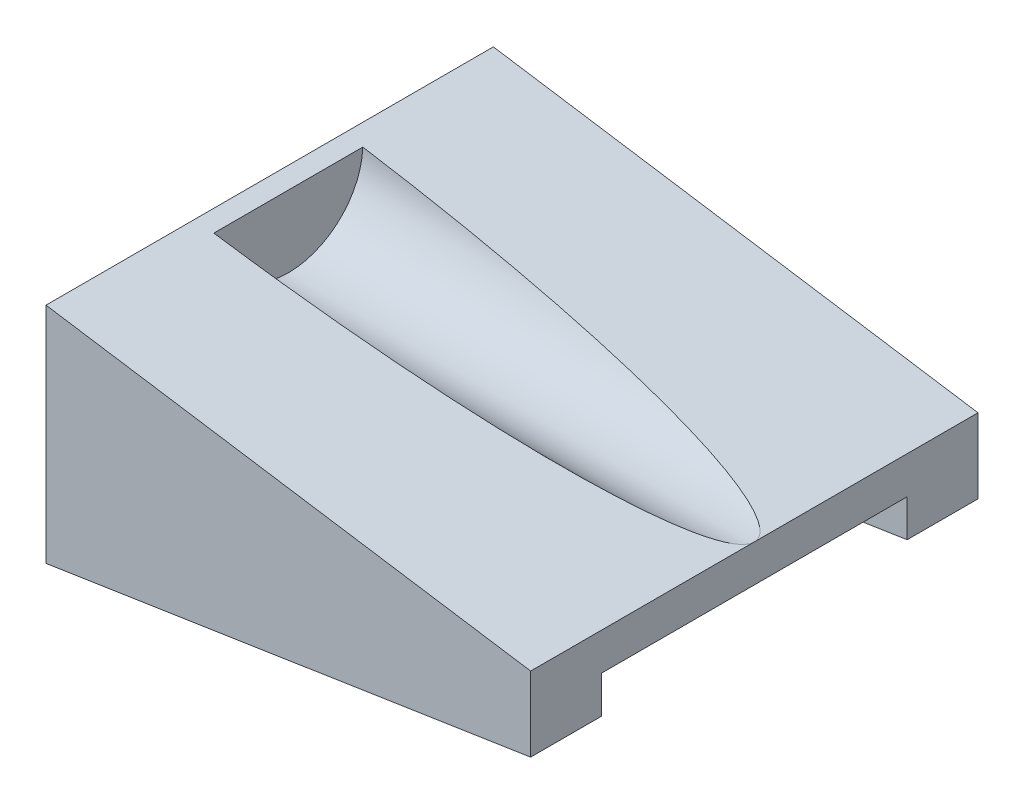
from build123d import *

# Parameters (mm, degrees)
SKETCH1_W           = 13
SKETCH1_H           = 12
BOSS_EXTRUDE1_DEPTH = 3
SKETCH2_W           = 13
SKETCH2_H           = 1.9
BOSS_EXTRUDE2_DEPTH = 3
CHAMFER1_SIZE       = 13
CHAMFER1_SIZE_2     = 2
CUT_EXTRUDE1_REACH  = 17.129
CUT_EXTRUDE1_START  = -0.5


with BuildPart() as part:
    # Sketch1 → Boss-Extrude1 (new body)
    with BuildSketch(Plane(origin=(0, 0, 0), x_dir=(1, 0, 0), z_dir=(0, 1, 0))):
        Rectangle(SKETCH1_W, SKETCH1_H)
    extrude(amount=BOSS_EXTRUDE1_DEPTH)

    # Sketch2 → Boss-Extrude2 (add)
    with BuildSketch(Plane.XZ):
        with Locations((0, 5.05)):
            Rectangle(SKETCH2_W, SKETCH2_H)
        with Locations((0, -5.05)):
            Rectangle(SKETCH2_W, SKETCH2_H)
    extrude(amount=BOSS_EXTRUDE2_DEPTH)

    # Chamfer1
    # the kernel refuses this chamfer: 13, 2 mm, written as the material it takes off along each edge
    with BuildSketch(Plane(origin=(6.5, -3, 39.785461495), x_dir=(-0.9999828835142526, -0.005850869894363576, 0), z_dir=(0, 0, -1))) as chamfer1_piece_1:
        Polygon((CHAMFER1_SIZE * 0.999982883514, CHAMFER1_SIZE * 0.00585086989436), (-CHAMFER1_SIZE_2 * 0.00585086989436, CHAMFER1_SIZE_2 * 0.999982883514), (0, 0), align=None)
    extrude(amount=69.470922991, mode=Mode.SUBTRACT)
    with BuildSketch(Plane(origin=(6.5, -3, -39.785461495), x_dir=(-0.9999828835142526, -0.005850869894363576, 0), z_dir=(0, 0, 1))) as chamfer1_piece_2:
        Polygon((CHAMFER1_SIZE * 0.999982883514, -CHAMFER1_SIZE * 0.00585086989436), (-CHAMFER1_SIZE_2 * 0.00585086989436, -CHAMFER1_SIZE_2 * 0.999982883514), (0, 0), align=None)
    extrude(amount=69.470922991, mode=Mode.SUBTRACT)
    with BuildSketch(Plane(origin=(6.5, 3, 39.785461495), x_dir=(0.23997968203750644, -0.9707779108576674, 0), z_dir=(0, 0, -1))) as chamfer1_piece_3:
        Polygon((CHAMFER1_SIZE_2 * 0.970777910858, CHAMFER1_SIZE_2 * 0.239979682038), (-CHAMFER1_SIZE * 0.239979682038, CHAMFER1_SIZE * 0.970777910858), (0, 0), align=None)
    extrude(amount=79.570922991, mode=Mode.SUBTRACT)

    # Sketch5 → Cut-Extrude1 (cut, up to next)
    with BuildSketch(Plane.ZY.offset(6.5).offset(CUT_EXTRUDE1_START), mode=Mode.PRIVATE) as cut_extrude1_sk1:
        with BuildLine():
            Line((-2, 3), (2, 3))
            ThreePointArc((2, 3), (0, 1), (-2, 3))
        make_face()
    cut_extrude1_tool1 = extrude(cut_extrude1_sk1.sketch, amount=-CUT_EXTRUDE1_REACH, mode=Mode.PRIVATE) & part.part
    add(cut_extrude1_tool1.solids().sort_by_distance((-6, 2.151174, 0))[0], mode=Mode.SUBTRACT)


solid = part.part
